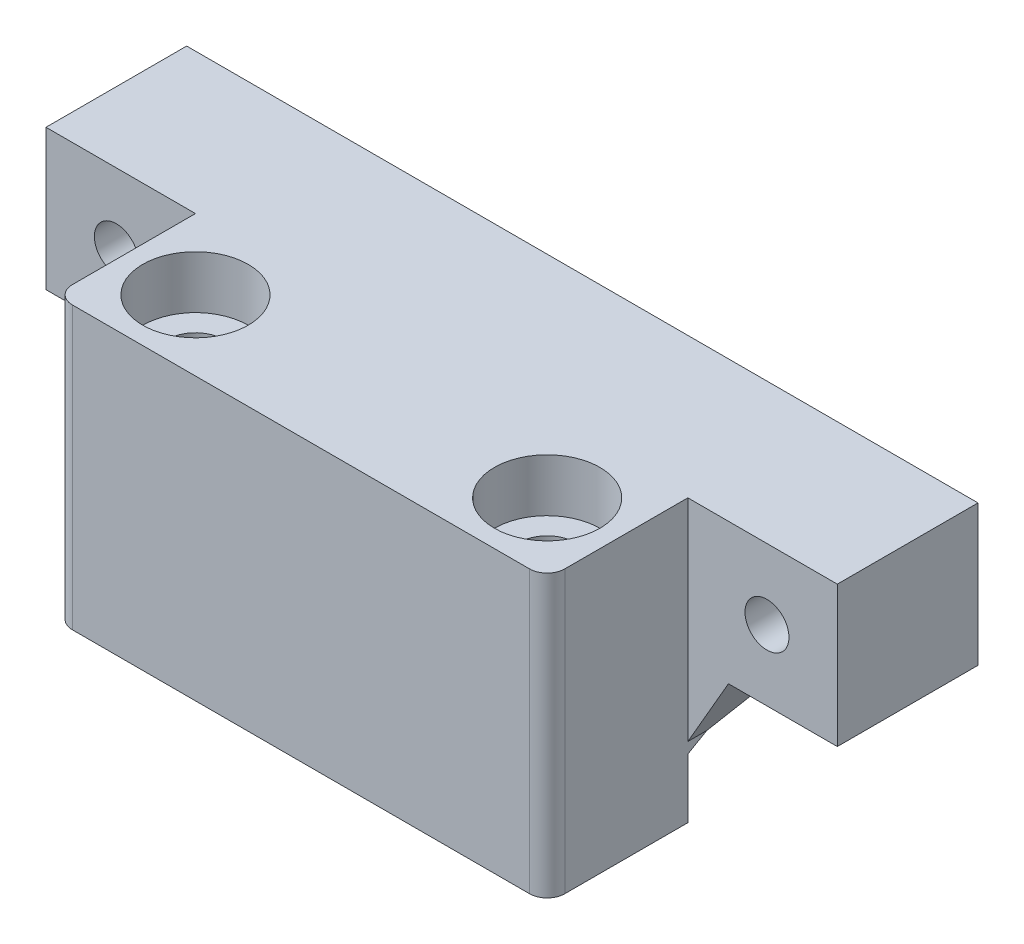
from build123d import *
from OCP.BRepFilletAPI import BRepFilletAPI_MakeChamfer

# Parameters (mm, degrees)
SKETCH_1_W           = 45
SKETCH_1_H           = 8
SKETCH_1_R           = 1.25
EXTRUDE_1_DEPTH      = 8
EXTRUDE_2_DEPTH      = 8
EXTRUDE_2_DEPTH_BACK = 8
SKETCH_2_W           = 28
SKETCH_2_H           = 8
SKETCH_2_R           = 1.6
SKETCH_4_R           = 3
CUT_EXTRUDE_2_DEPTH  = 3
FILLET_1_R           = 1
CHAMFER_1_SIZE2      = 8
CHAMFER_1_SIZE       = 4.618802154
CHAMFER_2_SIZE       = 4
CHAMFER_2_SIZE2      = 2.309401077
SKETCH_5_R           = 2.1
CUT_EXTRUDE_3_DEPTH  = 5


with BuildPart() as part:
    # ｽｹｯﾁ1 → ﾎﾞｽ - 押し出し1 (new body)
    with BuildSketch(Plane.XY):
        Rectangle(SKETCH_1_W, SKETCH_1_H)
        with Locations((-18.5, 0)):
            Circle(SKETCH_1_R, mode=Mode.SUBTRACT)
        with Locations(Location((18.5, 0, 0), (0, 0, 180))):
            Circle(SKETCH_1_R, mode=Mode.SUBTRACT)
    extrude(amount=EXTRUDE_1_DEPTH)

    # ｽｹｯﾁ2 → ﾎﾞｽ - 押し出し2 (add, two sides: drawn at the far end of the back side and taken through both)
    with BuildSketch(Plane.XZ.offset(4).offset(-EXTRUDE_2_DEPTH_BACK)):
        with Locations((0, 12)):
            Rectangle(SKETCH_2_W, SKETCH_2_H)
        with Locations(Location((-10, 12, 0), (0, 0, 270))):
            Circle(SKETCH_2_R, mode=Mode.SUBTRACT)
        with Locations(Location((10, 12, 0), (0, 0, 90))):
            Circle(SKETCH_2_R, mode=Mode.SUBTRACT)
    extrude(amount=EXTRUDE_2_DEPTH + EXTRUDE_2_DEPTH_BACK)

    # ｽｹｯﾁ4 → ｶｯﾄ - 押し出し2 (cut)
    with BuildSketch(Plane(origin=(0, 4, 0), x_dir=(1, 0, 0), z_dir=(0, 1, 0))):
        with Locations(Location((10, -12, 0), (0, 0, 270))):
            Circle(SKETCH_4_R)
        with Locations(Location((-10, -12, 0), (0, 0, 90))):
            Circle(SKETCH_4_R)
    extrude(amount=-CUT_EXTRUDE_2_DEPTH, mode=Mode.SUBTRACT)

    # ﾌｨﾚｯﾄ1
    fillet_1_edges = [part.edges().sort_by_distance(p)[0] for p in [
        (14, -4, 16),
        (-14, -4, 16),
    ]]
    fillet(fillet_1_edges, radius=FILLET_1_R)

    # 面取り1
    chamfer_1_edges = [part.edges().sort_by_distance(p)[0] for p in [
        (0, -4, 8),
    ]]
    chamfer_1_side = [part.faces().sort_by_distance(p)[0] for p in [
        (0, -4.092376043, 8),
    ]]
    chamfer(chamfer_1_edges, length=CHAMFER_1_SIZE - 0.0001, length2=CHAMFER_1_SIZE2 - 0.0001, reference=chamfer_1_side[0])  # a hair under: the kernel refuses the full size

    # 面取り2: one chamfer whose edges measure the first distance from different faces: ONE call of the kernel's chamfer builder (chamfer() names one face for all edges)
    chamfer_2_edges_1 = [part.edges().sort_by_distance(p)[0] for p in [
        (-14, -4, 4.00005),
    ]]
    chamfer_2_side_1 = [part.faces().sort_by_distance(p)[0] for p in [
        (-14, -4.217995396, 10.626834142),
    ]]
    chamfer_2_edges_2 = [part.edges().sort_by_distance(p)[0] for p in [
        (14, -4, 4.00005),
    ]]
    chamfer_2_side_2 = [part.faces().sort_by_distance(p)[0] for p in [
        (14, -4.217995396, 10.626834142),
    ]]
    chamfer_2 = BRepFilletAPI_MakeChamfer(part.part.solid().wrapped)
    for e in chamfer_2_edges_1:
        chamfer_2.Add(CHAMFER_2_SIZE, CHAMFER_2_SIZE2, e.wrapped, chamfer_2_side_1[0].wrapped)  # the first distance lies on this face
    for e in chamfer_2_edges_2:
        chamfer_2.Add(CHAMFER_2_SIZE, CHAMFER_2_SIZE2, e.wrapped, chamfer_2_side_2[0].wrapped)  # the first distance lies on this face
    add(Compound.cast(chamfer_2.Shape()), mode=Mode.REPLACE)

    # ｽｹｯﾁ5 → ｶｯﾄ - 押し出し3 (cut)
    with BuildSketch(Plane(origin=(0, 0, 0), x_dir=(-1, 0, 0), z_dir=(0, 0, -1))):
        with Locations((-18.5, 0)):
            Circle(SKETCH_5_R)
        with Locations((18.5, 0)):
            Circle(SKETCH_5_R)
    extrude(amount=-CUT_EXTRUDE_3_DEPTH, mode=Mode.SUBTRACT)


solid = part.part
